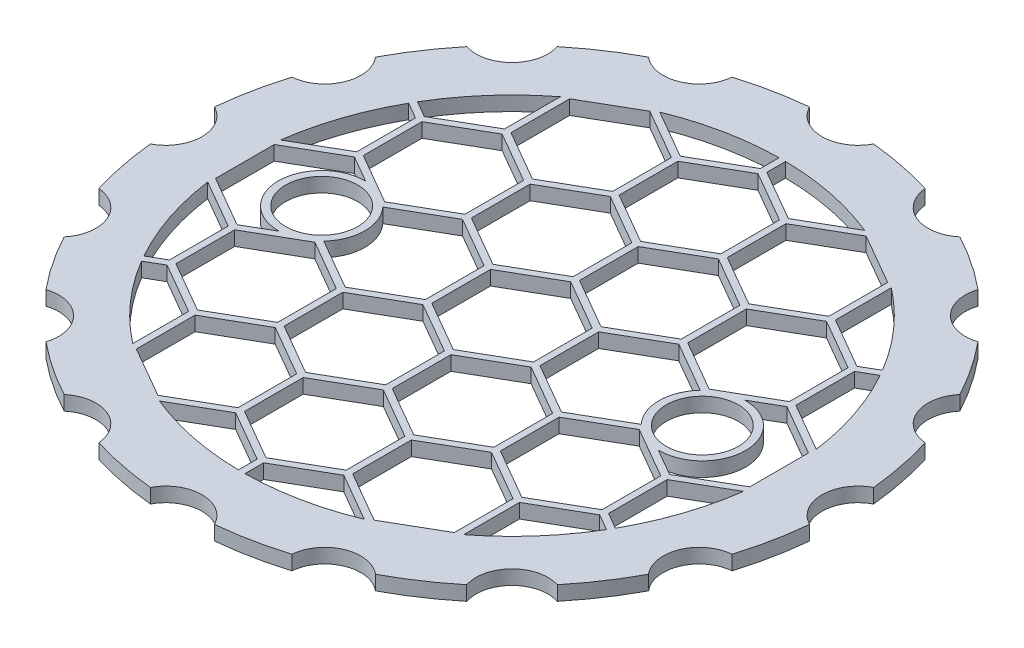
from build123d import *

# Parameters (mm, degrees)
SKETCH3_R           = 20
BOSS_EXTRUDE3_DEPTH = 1
FILL_PATTERN1_DEPTH = 1
BOSS_EXTRUDE1_DEPTH = 1
SKETCH1_4_R         = 3
CUT_EXTRUDE1_DEPTH  = 23
SKETCH1_5_R         = 3
SKETCH1_5_R_2       = 2.5
BOSS_EXTRUDE4_DEPTH = 1


# Read off the part's stored shape, not the designer's step: Fill Pattern1
with BuildPart() as part:
    # Sketch3 → Boss-Extrude3 (new body)
    with BuildSketch(Plane(origin=(0, 0, 0), x_dir=(1, 0, 0), z_dir=(0, 1, 0))):
        with Locations(Location((0, 0, 0), (0, 0, 270))):
            Circle(SKETCH3_R)
    extrude(amount=BOSS_EXTRUDE3_DEPTH)

    # Fill Pattern1 outline → Fill Pattern1 (cut)
    with BuildSketch(Plane(origin=(0, 0, 0), x_dir=(1, 0, 0), z_dir=(0, 1, 0))):
        with BuildLine():
            Line((-18.975, 2.035163071), (-19.838834637, 2.533898231))
            ThreePointArc((-19.838834637, 2.533898231), (-20, 3.166e-06), (-19.838835439, -2.533891951))
            Line((-19.838835439, -2.533891951), (-18.975, -2.035156327))
            Line((-18.975, -2.035156327), (-18.975, 2.035163071))
        make_face()
        with BuildLine():
            ThreePointArc((-17.431910546, 9.804513997), (-18.908964693, 6.515447355), (-19.771494112, 3.014634403))
            Line((-19.771494112, 3.014634403), (-18.75, 2.424874502))
            Line((-18.75, 2.424874502), (-15.225, 4.460034201))
            Line((-15.225, 4.460034201), (-15.225, 8.530353599))
            Line((-15.225, 8.530353599), (-17.431910546, 9.804513997))
        make_face()
        with BuildLine():
            Line((-18.75, -2.424867759), (-19.771495057, -3.014628205))
            ThreePointArc((-19.771495057, -3.014628205), (-18.908966666, -6.51544163), (-17.431913409, -9.804508906))
            Line((-17.431913409, -9.804508906), (-15.225, -8.530346856))
            Line((-15.225, -8.530346856), (-15.225, -4.460027458))
            Line((-15.225, -4.460027458), (-18.75, -2.424867759))
        make_face()
        with BuildLine():
            ThreePointArc((-12.496492137, 15.615302888), (-15.097021302, 13.117924677), (-17.206910489, 10.194225396))
            Line((-17.206910489, 10.194225396), (-15, 8.920065031))
            Line((-15, 8.920065031), (-11.475, 10.95522473))
            Line((-11.475, 10.95522473), (-11.475, 15.025544127))
            Line((-11.475, 15.025544127), (-12.496492137, 15.615302888))
        make_face()
        with BuildLine():
            Line((-15, -8.920058287), (-17.206913466, -10.194220371))
            ThreePointArc((-17.206913466, -10.194220371), (-15.097025273, -13.117920106), (-12.496497032, -15.61529897))
            Line((-12.496497032, -15.61529897), (-11.475, -15.025537384))
            Line((-11.475, -15.025537384), (-11.475, -10.955217986))
            Line((-11.475, -10.955217986), (-15, -8.920058287))
        make_face()
        with BuildLine():
            ThreePointArc((-7.725, 18.44788267), (-9.999998629, 17.320508867), (-12.113832519, 15.913989497))
            Line((-12.113832519, 15.913989497), (-11.25, 15.415255559))
            Line((-11.25, 15.415255559), (-7.725, 17.450415258))
            Line((-7.725, 17.450415258), (-7.725, 18.44788267))
        make_face()
        with BuildLine():
            Line((-11.25, -15.415248816), (-12.113837557, -15.913985662))
            ThreePointArc((-12.113837557, -15.913985662), (-10.000001371, -17.320507284), (-7.725, -18.44788267))
            Line((-7.725, -18.44788267), (-7.725, -17.450408515))
            Line((-7.725, -17.450408515), (-11.25, -15.415248816))
        make_face()
        with BuildLine():
            ThreePointArc((-0.225, 19.998734335), (-3.811942392, 19.633366884), (-7.275, 18.629932233))
            Line((-7.275, 18.629932233), (-7.275, 17.450415258))
            Line((-7.275, 17.450415258), (-3.75, 15.415255559))
            Line((-3.75, 15.415255559), (-0.225, 17.450415258))
            Line((-0.225, 17.450415258), (-0.225, 19.998734335))
        make_face()
        with BuildLine():
            Line((-7.275, -17.450408515), (-7.275, -18.629932233))
            ThreePointArc((-7.275, -18.629932233), (-3.811942392, -19.633366884), (-0.225, -19.998734335))
            Line((-0.225, -19.998734335), (-0.225, -17.450408515))
            Line((-0.225, -17.450408515), (-3.75, -15.415248816))
            Line((-3.75, -15.415248816), (-7.275, -17.450408515))
        make_face()
        with BuildLine():
            ThreePointArc((7.275, 18.629932233), (3.811942392, 19.633366884), (0.225, 19.998734335))
            Line((0.225, 19.998734335), (0.225, 17.450415258))
            Line((0.225, 17.450415258), (3.75, 15.415255559))
            Line((3.75, 15.415255559), (7.275, 17.450415258))
            Line((7.275, 17.450415258), (7.275, 18.629932233))
        make_face()
        with BuildLine():
            Line((0.225, -17.450408515), (0.225, -19.998734335))
            ThreePointArc((0.225, -19.998734335), (3.811942392, -19.633366884), (7.275, -18.629932233))
            Line((7.275, -18.629932233), (7.275, -17.450408515))
            Line((7.275, -17.450408515), (3.75, -15.415248816))
            Line((3.75, -15.415248816), (0.225, -17.450408515))
        make_face()
        with BuildLine():
            ThreePointArc((12.113832519, 15.913989497), (9.999998629, 17.320508867), (7.725, 18.44788267))
            Line((7.725, 18.44788267), (7.725, 17.450415258))
            Line((7.725, 17.450415258), (11.25, 15.415255559))
            Line((11.25, 15.415255559), (12.113832519, 15.913989497))
        make_face()
        with BuildLine():
            Line((7.725, -17.450408515), (7.725, -18.44788267))
            ThreePointArc((7.725, -18.44788267), (10.000001371, -17.320507284), (12.113837557, -15.913985662))
            Line((12.113837557, -15.913985662), (11.25, -15.415248816))
            Line((11.25, -15.415248816), (7.725, -17.450408515))
        make_face()
        with BuildLine():
            ThreePointArc((17.206910489, 10.194225396), (15.097021302, 13.117924677), (12.496492137, 15.615302888))
            Line((12.496492137, 15.615302888), (11.475, 15.025544127))
            Line((11.475, 15.025544127), (11.475, 10.95522473))
            Line((11.475, 10.95522473), (15, 8.920065031))
            Line((15, 8.920065031), (17.206910489, 10.194225396))
        make_face()
        with BuildLine():
            Line((11.475, -15.025537384), (12.496497032, -15.61529897))
            ThreePointArc((12.496497032, -15.61529897), (15.097025273, -13.117920106), (17.206913466, -10.194220371))
            Line((17.206913466, -10.194220371), (15, -8.920058287))
            Line((15, -8.920058287), (11.475, -10.955217986))
            Line((11.475, -10.955217986), (11.475, -15.025537384))
        make_face()
        with BuildLine():
            ThreePointArc((19.771494112, 3.014634403), (18.908964693, 6.515447355), (17.431910546, 9.804513997))
            Line((17.431910546, 9.804513997), (15.225, 8.530353599))
            Line((15.225, 8.530353599), (15.225, 4.460034201))
            Line((15.225, 4.460034201), (18.75, 2.424874502))
            Line((18.75, 2.424874502), (19.771494112, 3.014634403))
        make_face()
        with BuildLine():
            Line((15.225, -8.530346856), (17.431913409, -9.804508906))
            ThreePointArc((17.431913409, -9.804508906), (18.908966666, -6.51544163), (19.771495057, -3.014628205))
            Line((19.771495057, -3.014628205), (18.75, -2.424867759))
            Line((18.75, -2.424867759), (15.225, -4.460027458))
            Line((15.225, -4.460027458), (15.225, -8.530346856))
        make_face()
        with BuildLine():
            ThreePointArc((19.838835439, -2.533891951), (20, 3.166e-06), (19.838834637, 2.533898231))
            Line((19.838834637, 2.533898231), (18.975, 2.035163071))
            Line((18.975, 2.035163071), (18.975, -2.035156327))
            Line((18.975, -2.035156327), (19.838835439, -2.533891951))
        make_face()
        Polygon((-7.725, -4.460027458), (-11.25, -2.424867759), (-14.775, -4.460027458), (-14.775, -8.530346856), (-11.25, -10.565506555), (-7.725, -8.530346856), align=None)
        Polygon((3.525, -10.955217986), (0, -8.920058287), (-3.525, -10.955217986), (-3.525, -15.025537384), (0, -17.060697083), (3.525, -15.025537384), align=None)
        Polygon((-11.25, 2.424874502), (-7.725, 4.460034201), (-7.725, 8.530353599), (-11.25, 10.565513298), (-14.775, 8.530353599), (-14.775, 4.460034201), align=None)
        Polygon((0, 8.920065031), (3.525, 10.95522473), (3.525, 15.025544127), (0, 17.060703826), (-3.525, 15.025544127), (-3.525, 10.95522473), align=None)
        Polygon((11.025, 15.025544127), (7.5, 17.060703826), (3.975, 15.025544127), (3.975, 10.95522473), (7.5, 8.920065031), (11.025, 10.95522473), align=None)
        Polygon((-15, 4.070322769), (-18.525, 2.035163071), (-18.525, -2.035156327), (-15, -4.070316026), (-11.475, -2.035156327), (-11.475, 2.035163071), align=None)
        Polygon((-3.75, 10.565513298), (-7.275, 8.530353599), (-7.275, 4.460034201), (-3.75, 2.424874502), (-0.225, 4.460034201), (-0.225, 8.530353599), align=None)
        Polygon((3.975, -10.955217986), (3.975, -15.025537384), (7.5, -17.060697083), (11.025, -15.025537384), (11.025, -10.955217986), (7.5, -8.920058287), align=None)
        Polygon((3.975, 2.035163071), (3.975, -2.035156327), (7.5, -4.070316026), (11.025, -2.035156327), (11.025, 2.035163071), (7.5, 4.070322769), align=None)
        Polygon((0.225, 8.530353599), (0.225, 4.460034201), (3.75, 2.424874502), (7.275, 4.460034201), (7.275, 8.530353599), (3.75, 10.565513298), align=None)
        Polygon((0.225, -4.460027458), (0.225, -8.530346856), (3.75, -10.565506555), (7.275, -8.530346856), (7.275, -4.460027458), (3.75, -2.424867759), align=None)
        Polygon((-7.5, 8.920065031), (-3.975, 10.95522473), (-3.975, 15.025544127), (-7.5, 17.060703826), (-11.025, 15.025544127), (-11.025, 10.95522473), align=None)
        Polygon((7.725, 8.530353599), (7.725, 4.460034201), (11.25, 2.424874502), (14.775, 4.460034201), (14.775, 8.530353599), (11.25, 10.565513298), align=None)
        Polygon((7.725, -4.460027458), (7.725, -8.530346856), (11.25, -10.565506555), (14.775, -8.530346856), (14.775, -4.460027458), (11.25, -2.424867759), align=None)
        Polygon((-7.5, 4.070322769), (-11.025, 2.035163071), (-11.025, -2.035156327), (-7.5, -4.070316026), (-3.975, -2.035156327), (-3.975, 2.035163071), align=None)
        Polygon((11.475, 2.035163071), (11.475, -2.035156327), (15, -4.070316026), (18.525, -2.035156327), (18.525, 2.035163071), (15, 4.070322769), align=None)
        Polygon((-3.975, -10.955217986), (-7.5, -8.920058287), (-11.025, -10.955217986), (-11.025, -15.025537384), (-7.5, -17.060697083), (-3.975, -15.025537384), align=None)
        Polygon((0, 4.070322769), (-3.525, 2.035163071), (-3.525, -2.035156327), (0, -4.070316026), (3.525, -2.035156327), (3.525, 2.035163071), align=None)
        Polygon((-0.225, -4.460027458), (-3.75, -2.424867759), (-7.275, -4.460027458), (-7.275, -8.530346856), (-3.75, -10.565506555), (-0.225, -8.530346856), align=None)
    extrude(amount=FILL_PATTERN1_DEPTH, mode=Mode.SUBTRACT)

    # Sketch1 → Boss-Extrude1 (add)
    with BuildSketch(Plane(origin=(0, 0, 0), x_dir=(1, 0, 0), z_dir=(0, 1, 0))):
        with BuildLine():
            ThreePointArc((-22.852325, 2.221000246), (-21.5, 0), (-22.852325, -2.221000246))
            ThreePointArc((-22.852325, -2.221000246), (-22.518830038, -4.479273793), (-21.962735335, -6.693269499))
            ThreePointArc((-21.962735335, -6.693269499), (-19.863409949, -8.227693796), (-20.26285534, -10.797142838))
            ThreePointArc((-20.26285534, -10.797142838), (-19.090542298, -12.75589255), (-17.729518309, -14.588549638))
            ThreePointArc((-17.729518309, -14.588549638), (-15.202795796, -15.202795796), (-14.588549638, -17.729518309))
            ThreePointArc((-14.588549638, -17.729518309), (-12.75589255, -19.090542298), (-10.797142838, -20.26285534))
            ThreePointArc((-10.797142838, -20.26285534), (-8.227693796, -19.863409949), (-6.693269499, -21.962735335))
            ThreePointArc((-6.693269499, -21.962735335), (-4.479273793, -22.518830038), (-2.221000246, -22.852325))
            ThreePointArc((-2.221000246, -22.852325), (0, -21.5), (2.221000246, -22.852325))
            ThreePointArc((2.221000246, -22.852325), (4.479273793, -22.518830038), (6.693269499, -21.962735335))
            ThreePointArc((6.693269499, -21.962735335), (8.227693796, -19.863409949), (10.797142838, -20.26285534))
            ThreePointArc((10.797142838, -20.26285534), (12.75589255, -19.090542298), (14.588549638, -17.729518309))
            ThreePointArc((14.588549638, -17.729518309), (15.202795796, -15.202795796), (17.729518309, -14.588549638))
            ThreePointArc((17.729518309, -14.588549638), (19.090542298, -12.75589255), (20.26285534, -10.797142838))
            ThreePointArc((20.26285534, -10.797142838), (19.863409949, -8.227693796), (21.962735335, -6.693269499))
            ThreePointArc((21.962735335, -6.693269499), (22.518830038, -4.479273793), (22.852325, -2.221000246))
            ThreePointArc((22.852325, -2.221000246), (21.5, 0), (22.852325, 2.221000246))
            ThreePointArc((22.852325, 2.221000246), (22.518830038, 4.479273793), (21.962735335, 6.693269499))
            ThreePointArc((21.962735335, 6.693269499), (19.863409949, 8.227693796), (20.26285534, 10.797142838))
            ThreePointArc((20.26285534, 10.797142838), (19.090542298, 12.75589255), (17.729518309, 14.588549638))
            ThreePointArc((17.729518309, 14.588549638), (15.202795796, 15.202795796), (14.588549638, 17.729518309))
            ThreePointArc((14.588549638, 17.729518309), (12.75589255, 19.090542298), (10.797142838, 20.26285534))
            ThreePointArc((10.797142838, 20.26285534), (8.227693796, 19.863409949), (6.693269499, 21.962735335))
            ThreePointArc((6.693269499, 21.962735335), (4.479273793, 22.518830038), (2.221000246, 22.852325))
            ThreePointArc((2.221000246, 22.852325), (0, 21.5), (-2.221000246, 22.852325))
            ThreePointArc((-2.221000246, 22.852325), (-4.479273793, 22.518830038), (-6.693269499, 21.962735335))
            ThreePointArc((-6.693269499, 21.962735335), (-8.227693796, 19.863409949), (-10.797142838, 20.26285534))
            ThreePointArc((-10.797142838, 20.26285534), (-12.75589255, 19.090542298), (-14.588549638, 17.729518309))
            ThreePointArc((-14.588549638, 17.729518309), (-15.202795796, 15.202795796), (-17.729518309, 14.588549638))
            ThreePointArc((-17.729518309, 14.588549638), (-19.090542298, 12.75589255), (-20.26285534, 10.797142838))
            ThreePointArc((-20.26285534, 10.797142838), (-19.863409949, 8.227693796), (-21.962735335, 6.693269499))
            ThreePointArc((-21.962735335, 6.693269499), (-22.518830038, 4.479273793), (-22.852325, 2.221000246))
        make_face()
        with BuildLine():
            Line((18.975, 2.035163071), (18.975, -2.035156327))
            Line((18.975, -2.035156327), (19.838835439, -2.533891951))
            ThreePointArc((19.838835439, -2.533891951), (19.806623825, -2.774464392), (19.771495057, -3.014628205))
            Line((19.771495057, -3.014628205), (18.75, -2.424867759))
            Line((18.75, -2.424867759), (18.579430112, -2.52334633))
            ThreePointArc((18.579430112, -2.52334633), (17.778643964, -5.956703686), (16.349308574, -9.179466714))
            Line((16.349308574, -9.179466714), (17.431913409, -9.804508906))
            ThreePointArc((17.431913409, -9.804508906), (17.320509536, -9.999997471), (17.206913466, -10.194220371))
            Line((17.206913466, -10.194220371), (16.124308635, -9.56917818))
            ThreePointArc((16.124308635, -9.56917818), (14.047981853, -12.418401904), (11.475, -14.828583041))
            Line((11.475, -14.828583041), (11.475, -15.025537384))
            Line((11.475, -15.025537384), (12.496497032, -15.61529897))
            ThreePointArc((12.496497032, -15.61529897), (12.306073524, -15.765803323), (12.113837557, -15.913985662))
            Line((12.113837557, -15.913985662), (11.25, -15.415248816))
            Line((11.25, -15.415248816), (7.725, -17.450408515))
            Line((7.725, -17.450408515), (7.725, -18.44788267))
            ThreePointArc((7.725, -18.44788267), (7.500552347, -18.540272773), (7.275, -18.629932233))
            Line((7.275, -18.629932233), (7.275, -17.450408515))
            Line((7.275, -17.450408515), (7.104433032, -17.35193163))
            ThreePointArc((7.104433032, -17.35193163), (3.730663836, -18.375109451), (0.225, -18.748649951))
            Line((0.225, -18.748649951), (0.225, -19.998734335))
            ThreePointArc((0.225, -19.998734335), (0, -20), (-0.225, -19.998734335))
            Line((-0.225, -19.998734335), (-0.225, -18.748649951))
            ThreePointArc((-0.225, -18.748649951), (-3.730663836, -18.375109451), (-7.104433032, -17.35193163))
            Line((-7.104433032, -17.35193163), (-7.275, -17.450408515))
            Line((-7.275, -17.450408515), (-7.275, -18.629932233))
            ThreePointArc((-7.275, -18.629932233), (-7.500552347, -18.540272773), (-7.725, -18.44788267))
            Line((-7.725, -18.44788267), (-7.725, -17.450408515))
            Line((-7.725, -17.450408515), (-11.25, -15.415248816))
            Line((-11.25, -15.415248816), (-12.113837557, -15.913985662))
            ThreePointArc((-12.113837557, -15.913985662), (-12.306073524, -15.765803323), (-12.496497032, -15.61529897))
            Line((-12.496497032, -15.61529897), (-11.475, -15.025537384))
            Line((-11.475, -15.025537384), (-11.475, -14.828583041))
            ThreePointArc((-11.475, -14.828583041), (-14.047981853, -12.418401904), (-16.124308635, -9.56917818))
            Line((-16.124308635, -9.56917818), (-17.206913466, -10.194220371))
            ThreePointArc((-17.206913466, -10.194220371), (-17.320509536, -9.999997471), (-17.431913409, -9.804508906))
            Line((-17.431913409, -9.804508906), (-16.349308574, -9.179466714))
            ThreePointArc((-16.349308574, -9.179466714), (-17.778643964, -5.956703686), (-18.579430112, -2.52334633))
            Line((-18.579430112, -2.52334633), (-18.75, -2.424867759))
            Line((-18.75, -2.424867759), (-19.771495057, -3.014628205))
            ThreePointArc((-19.771495057, -3.014628205), (-19.806623825, -2.774464392), (-19.838835439, -2.533891951))
            Line((-19.838835439, -2.533891951), (-18.975, -2.035156327))
            Line((-18.975, -2.035156327), (-18.975, 2.035163071))
            Line((-18.975, 2.035163071), (-19.838834637, 2.533898231))
            ThreePointArc((-19.838834637, 2.533898231), (-19.806622951, 2.774470631), (-19.771494112, 3.014634403))
            Line((-19.771494112, 3.014634403), (-18.75, 2.424874502))
            Line((-18.75, 2.424874502), (-18.579429119, 2.523353646))
            ThreePointArc((-18.579429119, 2.523353646), (-17.778641863, 5.956709955), (-16.349305715, 9.179471806))
            Line((-16.349305715, 9.179471806), (-17.431910546, 9.804513997))
            ThreePointArc((-17.431910546, 9.804513997), (-17.320506615, 10.000002529), (-17.206910489, 10.194225396))
            Line((-17.206910489, 10.194225396), (-16.124305654, 9.569183203))
            ThreePointArc((-16.124305654, 9.569183203), (-14.047979919, 12.418404092), (-11.475, 14.828583041))
            Line((-11.475, 14.828583041), (-11.475, 15.025544127))
            Line((-11.475, 15.025544127), (-12.496492137, 15.615302888))
            ThreePointArc((-12.496492137, 15.615302888), (-12.306068557, 15.7658072), (-12.113832519, 15.913989497))
            Line((-12.113832519, 15.913989497), (-11.25, 15.415255559))
            Line((-11.25, 15.415255559), (-7.725, 17.450415258))
            Line((-7.725, 17.450415258), (-7.725, 18.44788267))
            ThreePointArc((-7.725, 18.44788267), (-7.500552347, 18.540272773), (-7.275, 18.629932233))
            Line((-7.275, 18.629932233), (-7.275, 17.450415258))
            Line((-7.275, 17.450415258), (-7.104426199, 17.351934428))
            ThreePointArc((-7.104426199, 17.351934428), (-3.730660218, 18.375110186), (-0.225, 18.748649951))
            Line((-0.225, 18.748649951), (-0.225, 19.998734335))
            ThreePointArc((-0.225, 19.998734335), (0, 20), (0.225, 19.998734335))
            Line((0.225, 19.998734335), (0.225, 18.748649951))
            ThreePointArc((0.225, 18.748649951), (3.730660218, 18.375110186), (7.104426199, 17.351934428))
            Line((7.104426199, 17.351934428), (7.275, 17.450415258))
            Line((7.275, 17.450415258), (7.275, 18.629932233))
            ThreePointArc((7.275, 18.629932233), (7.500552347, 18.540272773), (7.725, 18.44788267))
            Line((7.725, 18.44788267), (7.725, 17.450415258))
            Line((7.725, 17.450415258), (11.25, 15.415255559))
            Line((11.25, 15.415255559), (12.113832519, 15.913989497))
            ThreePointArc((12.113832519, 15.913989497), (12.306068557, 15.7658072), (12.496492137, 15.615302888))
            Line((12.496492137, 15.615302888), (11.475, 15.025544127))
            Line((11.475, 15.025544127), (11.475, 14.828583041))
            ThreePointArc((11.475, 14.828583041), (14.047979919, 12.418404092), (16.124305654, 9.569183203))
            Line((16.124305654, 9.569183203), (17.206910489, 10.194225396))
            ThreePointArc((17.206910489, 10.194225396), (17.320506615, 10.000002529), (17.431910546, 9.804513997))
            Line((17.431910546, 9.804513997), (16.349305715, 9.179471806))
            ThreePointArc((16.349305715, 9.179471806), (17.778641863, 5.956709955), (18.579429119, 2.523353646))
            Line((18.579429119, 2.523353646), (18.75, 2.424874502))
            Line((18.75, 2.424874502), (19.771494112, 3.014634403))
            ThreePointArc((19.771494112, 3.014634403), (19.806622951, 2.774470631), (19.838834637, 2.533898231))
            Line((19.838834637, 2.533898231), (18.975, 2.035163071))
        make_face(mode=Mode.SUBTRACT)
    extrude(amount=BOSS_EXTRUDE1_DEPTH)

    # Sketch1<4> → Cut-Extrude1 (cut)
    with BuildSketch(Plane(origin=(0, 0, 0), x_dir=(1, 0, 0), z_dir=(0, 1, 0))):
        with Locations((-13.2, 0)):
            Circle(SKETCH1_4_R)
        with Locations((13.2, 0)):
            Circle(SKETCH1_4_R)
    extrude(amount=CUT_EXTRUDE1_DEPTH, mode=Mode.SUBTRACT)

    # Sketch1<5> → Boss-Extrude4 (add)
    # profile 1 of 2: a face of its own
    with BuildSketch(Plane(origin=(0, 0, 0), x_dir=(1, 0, 0), z_dir=(0, 1, 0))):
        with Locations((-13.2, 0)):
            Circle(SKETCH1_5_R)
        with Locations(Location((-13.2, 0, 0), (0, 0, 270))):
            Circle(SKETCH1_5_R_2, mode=Mode.SUBTRACT)
    # profile 2 of 2: a face of its own
    with BuildSketch(Plane(origin=(0, 0, 0), x_dir=(1, 0, 0), z_dir=(0, 1, 0))):
        with Locations((13.2, 0)):
            Circle(SKETCH1_5_R)
        with Locations(Location((13.2, 0, 0), (0, 0, 270))):
            Circle(SKETCH1_5_R_2, mode=Mode.SUBTRACT)
    extrude(amount=BOSS_EXTRUDE4_DEPTH)


solid = part.part
